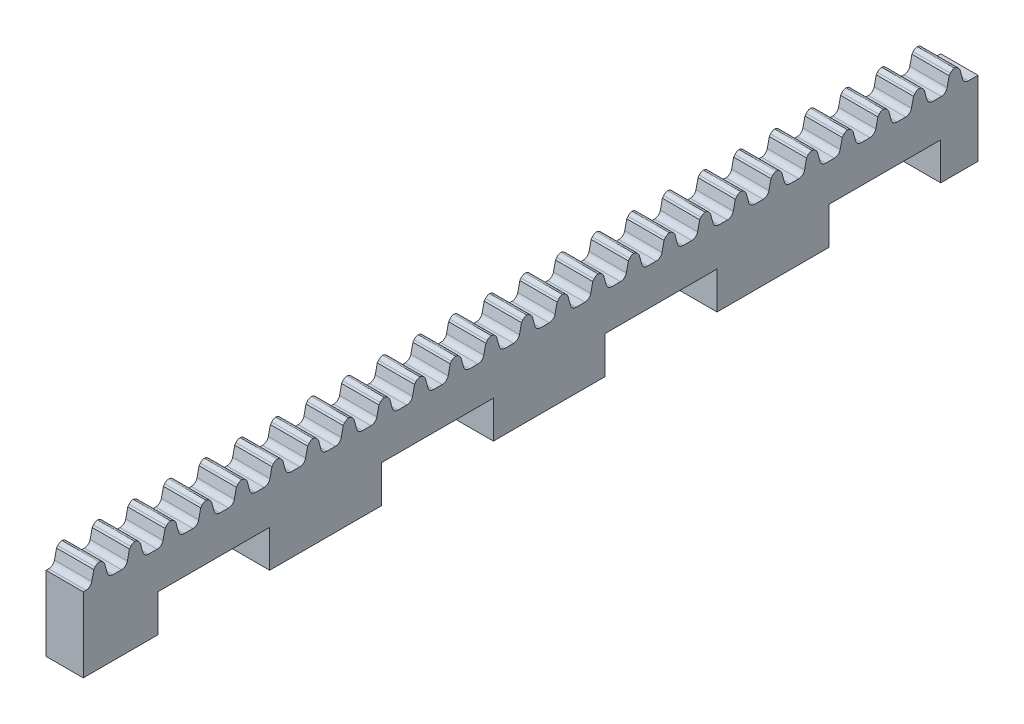
from build123d import *

# Parameters (mm, degrees)
SKETCH2_W              = 6.35
SKETCH2_H              = 6.35
BOSS_EXTRUDE1_DEPTH    = 76.2
BOSS_EXTRUDE2_DEPTH    = 6.35
FILLET2_R              = 1.016
FILLET1_R              = 1.016
LPATTERN1_COUNT        = 25
LPATTERN1_PITCH        = 6.0706
FILLET2_OF_LPATTERN1_R = 1.016
FILLET1_OF_LPATTERN1_R = 1.016
SKETCH4_W              = 152.4
SKETCH4_H              = 6.35
BOSS_EXTRUDE3_DEPTH    = 6.35
SKETCH5_W              = 19.05
SKETCH5_H              = 6.35
CUT_EXTRUDE1_DEPTH     = 78.055097982
LPATTERN2_COUNT        = 4
LPATTERN2_PITCH        = 38.1


with BuildPart() as part:
    # Sketch2 → Boss-Extrude1 (new, symmetric)
    with BuildSketch(Plane.XY):
        Rectangle(SKETCH2_W, SKETCH2_H)
    extrude(amount=BOSS_EXTRUDE1_DEPTH, both=True)

    # Sketch3 → Boss-Extrude2 (add)
    with BuildSketch(Plane(origin=(3.175, 0, 0), x_dir=(0, 0, -1), z_dir=(1, 0, 0))):
        Polygon((-74.93, 3.175), (-74.406938932, 5.560713913), (-73.889504331, 6.223), (-73.043158047, 6.223), (-72.561330413, 5.534375604), (-71.930006, 3.175), align=None)
    boss_extrude2 = extrude(amount=-BOSS_EXTRUDE2_DEPTH)

    # Fillet2
    # the kernel refuses this fillet: 1.016 mm, written as the material it takes off along each edge
    with BuildSketch(Plane(origin=(4.413840775, 6.223, 73.889504331), x_dir=(0, -0.7880107536067196, 0.6156614753256614), z_dir=(-1, 0, 0))) as fillet2_piece_1:
        with BuildLine():
            CenterArc((FILLET2_R * 0.487732588566, -FILLET2_R), FILLET2_R, 90, 52)
            Line((-FILLET2_R * 0.300278165041, -FILLET2_R * 0.384338524674), (0, 0))
            Line((0, 0), (FILLET2_R * 0.487732588566, 0))
        make_face()
    extrude(amount=8.82768155, mode=Mode.SUBTRACT)
    with BuildSketch(Plane(origin=(4.497794707, 6.223, 73.043158047), x_dir=(0, 0, 1), z_dir=(-1, 0, 0))) as fillet2_piece_2:
        with BuildLine():
            CenterArc((FILLET2_R * 0.520785317723, -FILLET2_R), FILLET2_R, 90, 55.019677054)
            Line((-FILLET2_R * 0.298563661251, -FILLET2_R * 0.42670491834), (0, 0))
            Line((0, 0), (FILLET2_R * 0.520785317723, 0))
        make_face()
    extrude(amount=8.995589414, mode=Mode.SUBTRACT)

    # Fillet1
    fillet1_edges = [part.edges().sort_by_distance(p)[0] for p in [
        (0, 3.175, 71.930006),
        (0, 3.175, 74.93),
    ]]
    fillet(fillet1_edges, radius=FILLET1_R)

    # LPattern1: Boss-Extrude2 ×25
    with Locations(*[(0, 0, -i * LPATTERN1_PITCH) for i in range(1, LPATTERN1_COUNT)]):
        add(boss_extrude2)

    # Fillet2 of LPattern1
    # the kernel refuses this fillet: 1.016 mm, written as the material it takes off along each edge
    with BuildSketch(Plane(origin=(4.413840775, 6.223, 67.818904331), x_dir=(0, -0.7880107536067243, 0.6156614753256553), z_dir=(-1, 0, 0)), Plane(origin=(4.413840775, 6.223, 61.748304331), x_dir=(0, -0.7880107536067201, 0.6156614753256607), z_dir=(-1, 0, 0)), Plane(origin=(4.413840775, 6.223, 55.677704331), x_dir=(0, -0.7880107536067243, 0.6156614753256553), z_dir=(-1, 0, 0)), Plane(origin=(4.413840775, 6.223, 49.607104331), x_dir=(0, -0.7880107536067222, 0.615661475325658), z_dir=(-1, 0, 0)), Plane(origin=(4.413840775, 6.223, 43.536504331), x_dir=(0, -0.7880107536067222, 0.615661475325658), z_dir=(-1, 0, 0)), Plane(origin=(4.413840775, 6.223, 37.465904331), x_dir=(0, -0.7880107536067222, 0.615661475325658), z_dir=(-1, 0, 0)), Plane(origin=(4.413840775, 6.223, 31.395304331), x_dir=(0, -0.7880107536067222, 0.615661475325658), z_dir=(-1, 0, 0)), Plane(origin=(4.413840775, 6.223, 25.324704331), x_dir=(0, -0.7880107536067222, 0.615661475325658), z_dir=(-1, 0, 0)), Plane(origin=(4.413840775, 6.223, 19.254104331), x_dir=(0, -0.7880107536067237, 0.6156614753256562), z_dir=(-1, 0, 0)), Plane(origin=(4.413840775, 6.223, 13.183504331), x_dir=(0, -0.7880107536067212, 0.6156614753256593), z_dir=(-1, 0, 0)), Plane(origin=(4.413840775, 6.223, 7.112904331), x_dir=(0, -0.7880107536067222, 0.615661475325658), z_dir=(-1, 0, 0)), Plane(origin=(4.413840775, 6.223, 1.042304331), x_dir=(0, -0.7880107536067213, 0.6156614753256591), z_dir=(-1, 0, 0)), Plane(origin=(4.413840775, 6.223, -5.028295669), x_dir=(0, -0.7880107536067222, 0.615661475325658), z_dir=(-1, 0, 0)), Plane(origin=(4.413840775, 6.223, -11.098895669), x_dir=(0, -0.7880107536067217, 0.6156614753256588), z_dir=(-1, 0, 0)), Plane(origin=(4.413840775, 6.223, -17.169495669), x_dir=(0, -0.7880107536067209, 0.6156614753256597), z_dir=(-1, 0, 0)), Plane(origin=(4.413840775, 6.223, -23.240095669), x_dir=(0, -0.7880107536067222, 0.615661475325658), z_dir=(-1, 0, 0)), Plane(origin=(4.413840775, 6.223, -29.310695669), x_dir=(0, -0.7880107536067222, 0.615661475325658), z_dir=(-1, 0, 0)), Plane(origin=(4.413840775, 6.223, -35.381295669), x_dir=(0, -0.7880107536067222, 0.615661475325658), z_dir=(-1, 0, 0)), Plane(origin=(4.413840775, 6.223, -41.451895669), x_dir=(0, -0.7880107536067243, 0.6156614753256553), z_dir=(-1, 0, 0)), Plane(origin=(4.413840775, 6.223, -47.522495669), x_dir=(0, -0.7880107536067222, 0.615661475325658), z_dir=(-1, 0, 0)), Plane(origin=(4.413840775, 6.223, -53.593095669), x_dir=(0, -0.7880107536067251, 0.6156614753256542), z_dir=(-1, 0, 0)), Plane(origin=(4.413840775, 6.223, -59.663695669), x_dir=(0, -0.7880107536067222, 0.615661475325658), z_dir=(-1, 0, 0)), Plane(origin=(4.413840775, 6.223, -65.734295669), x_dir=(0, -0.7880107536067196, 0.6156614753256614), z_dir=(-1, 0, 0)), Plane(origin=(4.413840775, 6.223, -71.804895669), x_dir=(0, -0.7880107536067196, 0.6156614753256614), z_dir=(-1, 0, 0))) as fillet2_of_lpattern1_piece_1:
        with BuildLine():
            CenterArc((FILLET2_OF_LPATTERN1_R * 0.487732588566, -FILLET2_OF_LPATTERN1_R), FILLET2_OF_LPATTERN1_R, 90, 52)
            Line((-FILLET2_OF_LPATTERN1_R * 0.300278165041, -FILLET2_OF_LPATTERN1_R * 0.384338524674), (0, 0))
            Line((0, 0), (FILLET2_OF_LPATTERN1_R * 0.487732588566, 0))
        make_face()
    extrude(amount=8.82768155, mode=Mode.SUBTRACT)
    with BuildSketch(Plane(origin=(4.497794707, 6.223, 66.972558047), x_dir=(0, 0, 1), z_dir=(-1, 0, 0)), Plane(origin=(4.497794707, 6.223, 60.901958047), x_dir=(0, 0, 1), z_dir=(-1, 0, 0)), Plane(origin=(4.497794707, 6.223, 54.831358047), x_dir=(0, 0, 1), z_dir=(-1, 0, 0)), Plane(origin=(4.497794707, 6.223, 48.760758047), x_dir=(0, 0, 1), z_dir=(-1, 0, 0)), Plane(origin=(4.497794707, 6.223, 42.690158047), x_dir=(0, 0, 1), z_dir=(-1, 0, 0)), Plane(origin=(4.497794707, 6.223, 36.619558047), x_dir=(0, 0, 1), z_dir=(-1, 0, 0)), Plane(origin=(4.497794707, 6.223, 30.548958047), x_dir=(0, 0, 1), z_dir=(-1, 0, 0)), Plane(origin=(4.497794707, 6.223, 24.478358047), x_dir=(0, 0, 1), z_dir=(-1, 0, 0)), Plane(origin=(4.497794707, 6.223, 18.407758047), x_dir=(0, 0, 1), z_dir=(-1, 0, 0)), Plane(origin=(4.497794707, 6.223, 12.337158047), x_dir=(0, 0, 1), z_dir=(-1, 0, 0)), Plane(origin=(4.497794707, 6.223, 6.266558047), x_dir=(0, 0, 1), z_dir=(-1, 0, 0)), Plane(origin=(4.497794707, 6.223, 0.195958047), x_dir=(0, 0, 1), z_dir=(-1, 0, 0)), Plane(origin=(4.497794707, 6.223, -5.874641953), x_dir=(0, 0, 1), z_dir=(-1, 0, 0)), Plane(origin=(4.497794707, 6.223, -11.945241953), x_dir=(0, 0, 1), z_dir=(-1, 0, 0)), Plane(origin=(4.497794707, 6.223, -18.015841953), x_dir=(0, 0, 1), z_dir=(-1, 0, 0)), Plane(origin=(4.497794707, 6.223, -24.086441953), x_dir=(0, 0, 1), z_dir=(-1, 0, 0)), Plane(origin=(4.497794707, 6.223, -30.157041953), x_dir=(0, 0, 1), z_dir=(-1, 0, 0)), Plane(origin=(4.497794707, 6.223, -36.227641953), x_dir=(0, 0, 1), z_dir=(-1, 0, 0)), Plane(origin=(4.497794707, 6.223, -42.298241953), x_dir=(0, 0, 1), z_dir=(-1, 0, 0)), Plane(origin=(4.497794707, 6.223, -48.368841953), x_dir=(0, 0, 1), z_dir=(-1, 0, 0)), Plane(origin=(4.497794707, 6.223, -54.439441953), x_dir=(0, 0, 1), z_dir=(-1, 0, 0)), Plane(origin=(4.497794707, 6.223, -60.510041953), x_dir=(0, 0, 1), z_dir=(-1, 0, 0)), Plane(origin=(4.497794707, 6.223, -66.580641953), x_dir=(0, 0, 1), z_dir=(-1, 0, 0)), Plane(origin=(4.497794707, 6.223, -72.651241953), x_dir=(0, 0, 1), z_dir=(-1, 0, 0))) as fillet2_of_lpattern1_piece_2:
        with BuildLine():
            CenterArc((FILLET2_OF_LPATTERN1_R * 0.520785317723, -FILLET2_OF_LPATTERN1_R), FILLET2_OF_LPATTERN1_R, 90, 55.019677054)
            Line((-FILLET2_OF_LPATTERN1_R * 0.298563661251, -FILLET2_OF_LPATTERN1_R * 0.42670491834), (0, 0))
            Line((0, 0), (FILLET2_OF_LPATTERN1_R * 0.520785317723, 0))
        make_face()
    extrude(amount=8.995589414, mode=Mode.SUBTRACT)

    # Fillet1 of LPattern1
    fillet1_of_lpattern1_edges = [part.edges().sort_by_distance(p)[0] for p in [
        (0, 3.175, 65.859406),
        (0, 3.175, 68.8594),
        (0, 3.175, 59.788806),
        (0, 3.175, 62.7888),
        (0, 3.175, 53.718206),
        (0, 3.175, 56.7182),
        (0, 3.175, 47.647606),
        (0, 3.175, 50.6476),
        (0, 3.175, 41.577006),
        (0, 3.175, 44.577),
        (0, 3.175, 35.506406),
        (0, 3.175, 38.5064),
        (0, 3.175, 29.435806),
        (0, 3.175, 32.4358),
        (0, 3.175, 23.365206),
        (0, 3.175, 26.3652),
        (0, 3.175, 17.294606),
        (0, 3.175, 20.2946),
        (0, 3.175, 11.224006),
        (0, 3.175, 14.224),
        (0, 3.175, 5.153406),
        (0, 3.175, 8.1534),
        (0, 3.175, -0.917194),
        (0, 3.175, 2.0828),
        (0, 3.175, -6.987794),
        (0, 3.175, -3.9878),
        (0, 3.175, -13.058394),
        (0, 3.175, -10.0584),
        (0, 3.175, -19.128994),
        (0, 3.175, -16.129),
        (0, 3.175, -25.199594),
        (0, 3.175, -22.1996),
        (0, 3.175, -31.270194),
        (0, 3.175, -28.2702),
        (0, 3.175, -37.340794),
        (0, 3.175, -34.3408),
        (0, 3.175, -43.411394),
        (0, 3.175, -40.4114),
        (0, 3.175, -49.481994),
        (0, 3.175, -46.482),
        (0, 3.175, -55.552594),
        (0, 3.175, -52.5526),
        (0, 3.175, -61.623194),
        (0, 3.175, -58.6232),
        (0, 3.175, -67.693794),
        (0, 3.175, -64.6938),
        (0, 3.175, -73.764394),
        (0, 3.175, -70.7644),
    ]]
    fillet(fillet1_of_lpattern1_edges, radius=FILLET1_OF_LPATTERN1_R)

    # Sketch4 → Boss-Extrude3 (add)
    with BuildSketch(Plane(origin=(3.175, 0, 0), x_dir=(0, 0, -1), z_dir=(1, 0, 0))):
        with Locations((0, -6.35)):
            Rectangle(SKETCH4_W, SKETCH4_H)
    extrude(amount=-BOSS_EXTRUDE3_DEPTH)

    # Sketch5 → Cut-Extrude1 (cut, through all)
    with BuildSketch(Plane(origin=(3.175, 0, 0), x_dir=(0, 0, -1), z_dir=(1, 0, 0))):
        with Locations((60.325, -6.35)):
            Rectangle(SKETCH5_W, SKETCH5_H)
    cut_extrude1 = extrude(amount=-CUT_EXTRUDE1_DEPTH, mode=Mode.SUBTRACT)

    # LPattern2: Cut-Extrude1 ×4
    with Locations(*[(0, 0, i * LPATTERN2_PITCH) for i in range(1, LPATTERN2_COUNT)]):
        add(cut_extrude1, mode=Mode.SUBTRACT)


solid = part.part
